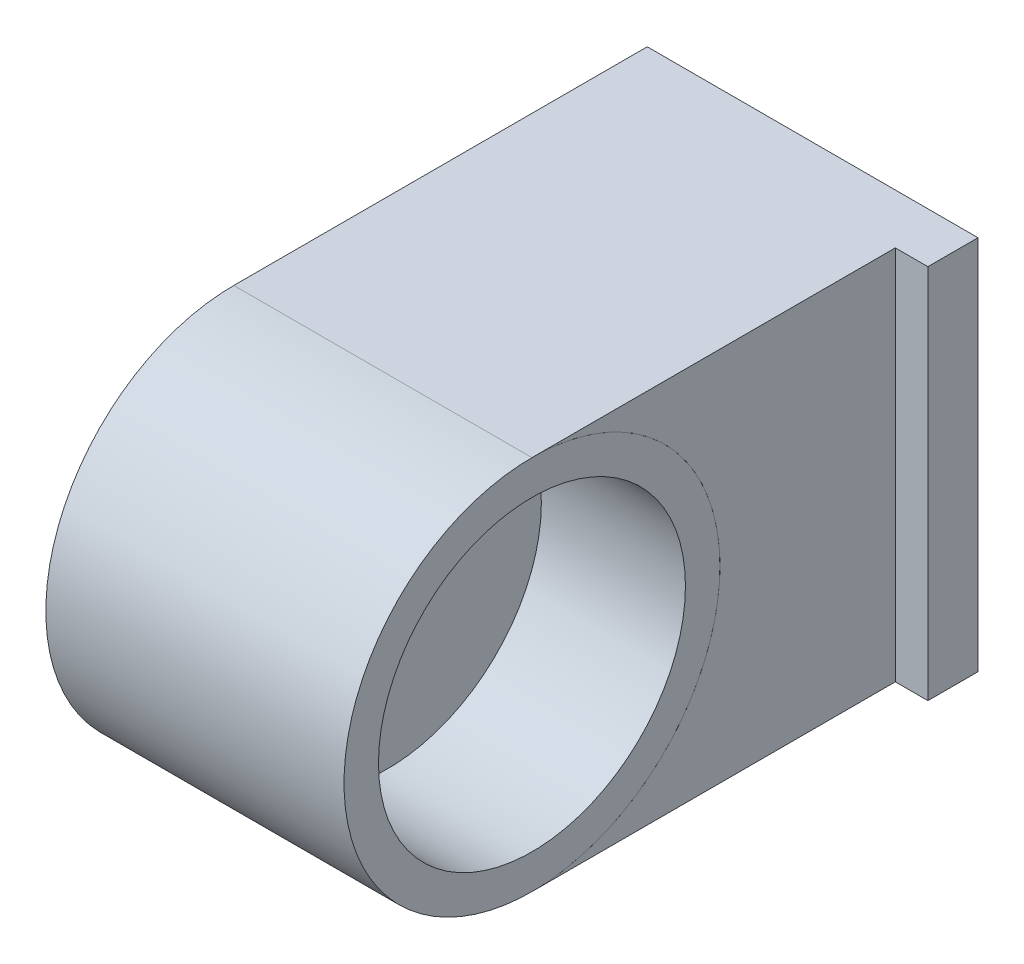
from build123d import *
from build123d.topology import SkipClean

# Parameters (mm, degrees)
SKETCH_1_R                       = 15
EXTRUDE_1_DEPTH                  = 4
M27X2_0_1_D                      = 24.5
SKETCH_5_R                       = 15
SKETCH_5_R_2                     = 12.25
EXTRUDE_2_DEPTH                  = 7.5
SKETCH_6_R                       = 15
EXTRUDE_3_DEPTH                  = 0.4
MIRROR_START                     = 11.9
MIRROR_1_OUTLINE_R               = 15
MIRROR_1_OUTLINE_R_2             = 12.25
MIRROR_1_DEPTH                   = 11.9
MIRROR_1_2_OUTLINE_R             = 12.25
MIRROR_1_2_DEPTH                 = 0.4
SKETCH_7_R                       = 0.5
CUT_EXTRUDE_2_DEPTH              = 25.521215304
SKETCH_9_W                       = 23.8
SKETCH_9_H                       = 30
EXTRUDE_4_DEPTH                  = 15
EXTRUDE_4_DIRECTION_2_REACH      = 43.127
EXTRUDE_4_DIRECTION_2_END_RADIUS = 15
SKETCH_19_R                      = 2
CUT_EXTRUDE_8_DEPTH              = 1
EXTRUDE_7_DEPTH                  = 3
EXTRUDE_7_DEPTH_BACK             = 1
SKETCH_10_W                      = 29
SKETCH_10_H                      = 29
SKETCH_10_W_2                    = 25
SKETCH_10_H_2                    = 25
SKETCH_20_R                      = 1
CUT_EXTRUDE_9_DEPTH              = 3
CUT_EXTRUDE_10_DEPTH             = 56.255859418
SKETCH_24_W                      = 2.6
SKETCH_24_H                      = 23.5
EXTRUDE_8_DEPTH                  = 1
SKETCH_25_W                      = 26.4
SKETCH_25_H                      = 6.5
EXTRUDE_9_DEPTH                  = 4
CUT_EXTRUDE_11_DEPTH             = 0.2


# Read off the part's stored shape, not the designer's step: 镜向1
with BuildPart() as part:
    # 草图1 → 凸台-拉伸1 (new body)
    with BuildSketch(Plane(origin=(0, 0, 0), x_dir=(0, 0, -1), z_dir=(1, 0, 0))):
        Circle(SKETCH_1_R)
    extrude(amount=EXTRUDE_1_DEPTH)

    # M27x2.0 螺纹孔1 (through all)
    with Locations(Plane.ZY):
        with Locations((0, 0)):
            Hole(M27X2_0_1_D / 2)

    # 草图5 → 凸台-拉伸2 (add)
    with SkipClean():  # the faces are left unmerged after this step: merging them gives an invalid solid
        with BuildSketch(Plane(origin=(4, 0, 0), x_dir=(0, 0, -1), z_dir=(1, 0, 0))):
            Circle(SKETCH_5_R)
            with Locations(Location((0, 0, 0), (0, 0, 180))):
                Circle(SKETCH_5_R_2, mode=Mode.SUBTRACT)
        extrude(amount=EXTRUDE_2_DEPTH)
    add(part.part.scale(1), mode=Mode.REPLACE)  # the faces are merged on a copy

    # 草图6 → 凸台-拉伸3 (add)
    with BuildSketch(Plane(origin=(11.5, 0, 0), x_dir=(0, 0, -1), z_dir=(1, 0, 0))):
        Circle(SKETCH_6_R)
    extrude(amount=EXTRUDE_3_DEPTH)

    # 镜向1 outline → 镜向1 (add)
    with BuildSketch(Plane.YZ.offset(MIRROR_START)):
        Circle(MIRROR_1_OUTLINE_R)
        Circle(MIRROR_1_OUTLINE_R_2, mode=Mode.SUBTRACT)
    extrude(amount=MIRROR_1_DEPTH)

    # Mirror 1 2 outline → Mirror 1 2 (add)
    with BuildSketch(Plane.YZ.offset(MIRROR_START)):
        Circle(MIRROR_1_2_OUTLINE_R)
    extrude(amount=MIRROR_1_2_DEPTH)

    # 草图7 → 切除-拉伸2 (cut, through all)
    with BuildSketch(Plane(origin=(12.3, 0, 0), x_dir=(0, 0, -1), z_dir=(1, 0, 0))):
        Circle(SKETCH_7_R)
    extrude(amount=-CUT_EXTRUDE_2_DEPTH, mode=Mode.SUBTRACT)

    # 草图26 → 切除-拉伸11 (cut)
    with BuildSketch(Plane.ZY.offset(-11.5)):
        with BuildLine():
            Line((-10, 0.25), (-0.968245837, 0.25))
            ThreePointArc((-0.968245837, 0.25), (-1, 0), (-0.968245837, -0.25))
            Line((-0.968245837, -0.25), (-10, -0.25))
            Line((-10, -0.25), (-10, 0.25))
        make_face()
        with BuildLine():
            Line((10, 0.25), (10, -0.25))
            Line((10, -0.25), (0.968245837, -0.25))
            ThreePointArc((0.968245837, -0.25), (1, 0), (0.968245837, 0.25))
            Line((0.968245837, 0.25), (10, 0.25))
        make_face()
        with BuildLine():
            Line((-0.25, 10), (0.25, 10))
            Line((0.25, 10), (0.25, 0.968245837))
            ThreePointArc((0.25, 0.968245837), (0, 1), (-0.25, 0.968245837))
            Line((-0.25, 0.968245837), (-0.25, 10))
        make_face()
        with BuildLine():
            Line((-0.25, -10), (0.25, -10))
            Line((0.25, -10), (0.25, -0.968245837))
            ThreePointArc((0.25, -0.968245837), (0, -1), (-0.25, -0.968245837))
            Line((-0.25, -0.968245837), (-0.25, -10))
        make_face()
    extrude(amount=-CUT_EXTRUDE_11_DEPTH, mode=Mode.SUBTRACT)


with BuildPart() as body_2:
    # 草图9 → 凸台-拉伸4 (new body)
    with BuildSketch(Plane(origin=(0, 0, -15), x_dir=(-1, 0, 0), z_dir=(0, 0, -1))):
        with Locations((-11.9, 0)):
            Rectangle(SKETCH_9_W, SKETCH_9_H)
    extrude(amount=EXTRUDE_4_DEPTH)

    # 凸台-拉伸4 direction 2: up to this cylinder (the profile starts outside it)
    extrude_4_direction_2_end = Plane(origin=(11.9, 0, 0), z_dir=(-1, 0, 0)) * Cylinder(EXTRUDE_4_DIRECTION_2_END_RADIUS, 117.254, mode=Mode.PRIVATE)
    # 草图9 → 凸台-拉伸4 direction 2 (add, up to the surface)
    with BuildSketch(Plane(origin=(0, 0, -15), x_dir=(-1, 0, 0), z_dir=(0, 0, -1)), mode=Mode.PRIVATE) as extrude_4_direction_2_sk1:
        with Locations((-11.9, 0)):
            Rectangle(SKETCH_9_W, SKETCH_9_H)
    extrude_4_direction_2_tool1 = extrude(extrude_4_direction_2_sk1.sketch, amount=-EXTRUDE_4_DIRECTION_2_REACH, mode=Mode.PRIVATE) - extrude_4_direction_2_end
    add(extrude_4_direction_2_tool1.solids().sort_by_distance((11.9, 0, -15))[0])
    add(extrude_4_direction_2_tool1.solids().sort_by_distance((11.9, 0, -15))[1])

    # 草图19 → 切除-拉伸8 (cut)
    with BuildSketch(Plane.ZY):
        with Locations((-20, 0)):
            Circle(SKETCH_19_R)
    extrude(amount=-CUT_EXTRUDE_8_DEPTH, mode=Mode.SUBTRACT)

    # 草图10 → 凸台-拉伸7 (add, two sides: drawn at the far end of the back side and taken through both)
    with BuildSketch(Plane(origin=(0, 0, -30), x_dir=(-1, 0, 0), z_dir=(0, 0, -1)).offset(-EXTRUDE_7_DEPTH_BACK)):
        with Locations((-11.9, -6)):
            Rectangle(SKETCH_10_W, SKETCH_10_H)
        with Locations((-11.9, -6)):
            Rectangle(SKETCH_10_W_2, SKETCH_10_H_2, mode=Mode.SUBTRACT)
    extrude(amount=EXTRUDE_7_DEPTH + EXTRUDE_7_DEPTH_BACK)

    # 草图20 → 切除-拉伸9 (cut)
    with BuildSketch(Plane(origin=(0, 0, -33), x_dir=(-1, 0, 0), z_dir=(0, 0, -1))):
        with Locations((-24.4, 6.5)):
            Circle(SKETCH_20_R)
    extrude(amount=-CUT_EXTRUDE_9_DEPTH, mode=Mode.SUBTRACT)

    # 草图22 → M4 螺纹孔2 (revolve, cut)
    with BuildSketch(Plane(origin=(11.9, -6, -30), x_dir=(0, 1, 0), z_dir=(1, 0, 0))):
        Polygon((0, 0), (0, 11.091420021), (1.65, 10.1), (1.65, 0), align=None)
    revolve(axis=Axis((11.9, -6, -36.35), (0, 0, 1)), mode=Mode.SUBTRACT)

    # 草图23 → 切除-拉伸10 (cut, through all)
    with BuildSketch(Plane.XY.offset(-29)):
        Polygon((24.4, -15), (26.4, -15), (26.4, -20.5), (-2.6, -20.5), (-2.6, 8.5), (0, 8.5), (0, 6.5), (-0.6, 6.5), (-0.6, -18.5), (24.4, -18.5), align=None)
    extrude(amount=-CUT_EXTRUDE_10_DEPTH, mode=Mode.SUBTRACT)

    # 草图24 → 凸台-拉伸8 (add)
    with BuildSketch(Plane.XY.offset(-29)):
        with Locations((25.1, -3.25)):
            Rectangle(SKETCH_24_W, SKETCH_24_H)
    extrude(amount=-EXTRUDE_8_DEPTH)

    # 草图25 → 凸台-拉伸9 (add)
    with BuildSketch(Plane(origin=(0, 0, -29), x_dir=(-1, 0, 0), z_dir=(0, 0, -1))):
        with Locations((-13.2, 11.75)):
            Rectangle(SKETCH_25_W, SKETCH_25_H)
    extrude(amount=EXTRUDE_9_DEPTH)


solid = Compound([part.part, body_2.part])
